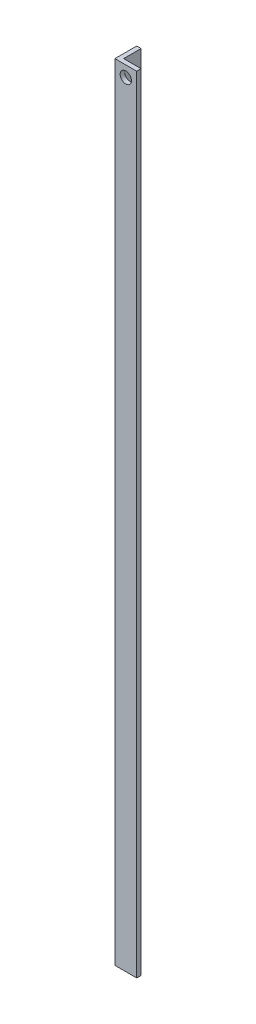
from build123d import *

# Parameters (mm, degrees)
BOSS_EXTRUDE1_DEPTH        = 360
F_6_0_204_DIAMETER_HOLE2_D = 5.1816
F_6_0_204_DIAMETER_HOLE3_D = 5.1816


with BuildPart() as part:
    # Sketch1 → Boss-Extrude1 (new body)
    with BuildSketch(Plane(origin=(0, 0, 0), x_dir=(1, 0, 0), z_dir=(0, 1, 0))):
        Polygon((0, 0), (0, 10), (2, 10), (2, 2), (10, 2), (10, 0), align=None)
    extrude(amount=BOSS_EXTRUDE1_DEPTH)

    # #6 (0.204) Diameter Hole2 (through all)
    with Locations(Plane.ZY):
        with Locations((-5, 5)):
            Hole(F_6_0_204_DIAMETER_HOLE2_D / 2)

    # #6 (0.204) Diameter Hole3 (through all)
    with Locations(Plane.XY):
        with Locations((5, 355)):
            Hole(F_6_0_204_DIAMETER_HOLE3_D / 2)


solid = part.part
